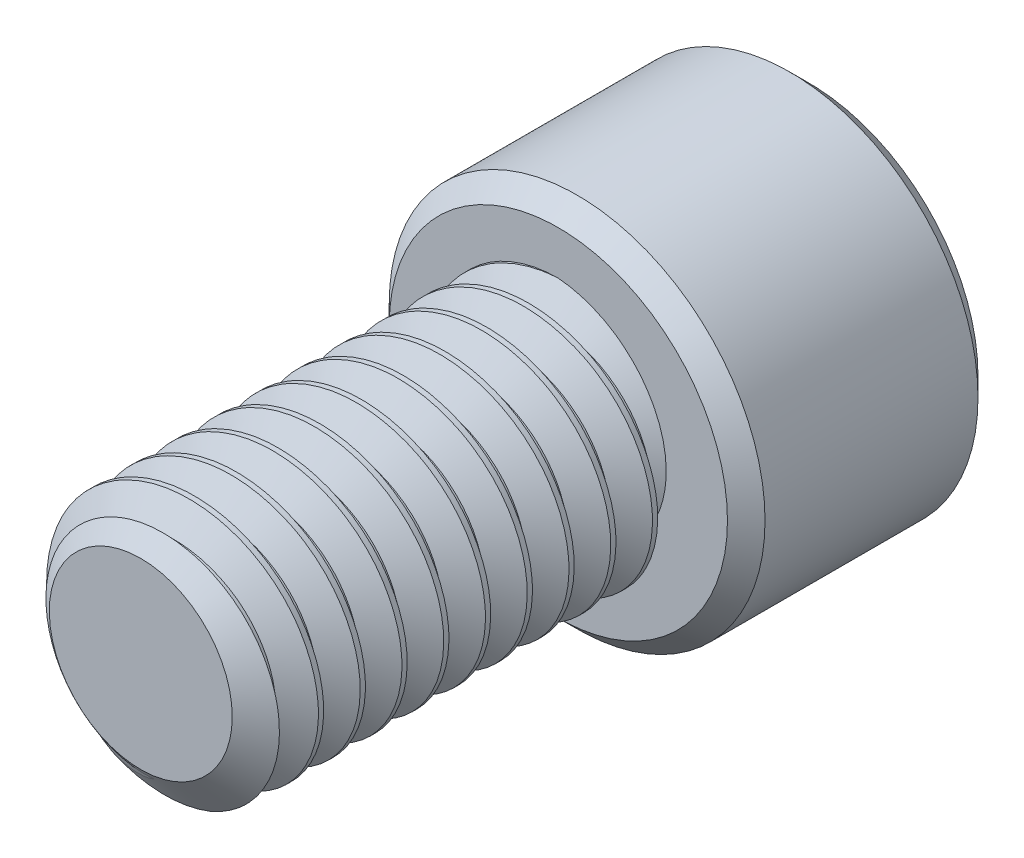
from build123d import *

# Parameters (mm, degrees)
SKETCH1_R          = 4.7625
EXTRUDE1_DEPTH     = 15.875
CUT_SWEEP1_PITCH   = 1.5875
SKETCH6_R          = 7.14375
EXTRUDE2_DEPTH     = 9.525
CUT_EXTRUDE1_DEPTH = 5.953125
CHAMFER1_SIZE      = 0.714375


with BuildPart() as part:
    # Sketch1 → Extrude1 (new body)
    with BuildSketch(Plane.XY):
        Circle(SKETCH1_R)
    extrude(amount=-EXTRUDE1_DEPTH)

    # Cut-Sweep1: the profile of Sketch3 profile screwed along a right-hand helix of 11 turns, 6 arcs to a turn; built about Z, then put on its axis
    cut_sweep1_z = Axis((0, 0, 0), (0, 0, 1))
    cut_sweep1_corners = [(4.7628, 0, -1.389235705), (3.731388504, 0, -0.79375), (3.731388504, 0, -0.5953125), (4.7628, 0, 0.000173205)]
    with BuildLine(mode=Mode.PRIVATE) as cut_sweep1_profile:
        Line(cut_sweep1_corners[0], cut_sweep1_corners[1])
        Line(cut_sweep1_corners[1], cut_sweep1_corners[2])
        Line(cut_sweep1_corners[2], cut_sweep1_corners[3])
        Line(cut_sweep1_corners[3], cut_sweep1_corners[0])
    cut_sweep1_cap = Face(cut_sweep1_profile.wire())
    cut_sweep1_turn_angles = [0, 30, 60, 90, 120, 150, 180, 210, 240, 270, 300, 330, 360]
    cut_sweep1_turn_weights = [1, 0.8660254037844387, 1, 0.8660254037844387, 1, 0.8660254037844387, 1, 0.8660254037844387, 1, 0.8660254037844387, 1, 0.8660254037844387, 1]
    cut_sweep1_turn_rails = [Edge.make_bspline([Vector(p[0], p[1], 0).rotate(cut_sweep1_z, cut_sweep1_turn_angles[k]) / cut_sweep1_turn_weights[k] + Vector(0, 0, p[2] + CUT_SWEEP1_PITCH * cut_sweep1_turn_angles[k] / 360) for k in range(13)], [0, 0, 0, 1, 1, 2, 2, 3, 3, 4, 4, 5, 5, 6, 6, 6], 2, cut_sweep1_turn_weights) for p in cut_sweep1_corners]
    cut_sweep1_turn_sides = [Face.make_surface_from_curves(cut_sweep1_turn_rails[p[0]], cut_sweep1_turn_rails[p[1]]) for p in [(0, 1), (1, 2), (2, 3), (3, 0)]]
    cut_sweep1 = Plane(origin=(0, 0, 0), x_dir=(0, 1, 0), z_dir=(0, 0, -1)) * Solid(Shell([*[p.moved(Location((0, 0, CUT_SWEEP1_PITCH * i))) for i in range(11) for p in cut_sweep1_turn_sides], cut_sweep1_cap, cut_sweep1_cap.rotate(cut_sweep1_z, 3960).moved(Location((0, 0, CUT_SWEEP1_PITCH * 3960 / 360)))]))
    add(cut_sweep1, mode=Mode.SUBTRACT)

    # Sketch4 → Cut-Revolve1 (revolve, cut)
    with BuildSketch(Plane(origin=(0, 0, 0), x_dir=(0, 0, -1), z_dir=(1, 0, 0)), mode=Mode.PRIVATE) as cut_revolve1_sk:
        Polygon((0.899844757, 4.7625), (0, 3.477388504), (0, 4.7625), align=None)
    revolve(cut_revolve1_sk.sketch.rotate(Axis((0, 0, 0), (0, 0, -1)), 219.91571201), axis=Axis((0, 0, 0), (0, 0, -1)), mode=Mode.SUBTRACT)

    # Sketch6 → Extrude2 (add)
    with BuildSketch(Plane(origin=(0, 0, -15.875), x_dir=(-1, 0, 0), z_dir=(0, 0, -1))):
        with Locations(Location((0, 0, 0), (0, 0, 180))):
            Circle(SKETCH6_R)
    extrude(amount=EXTRUDE2_DEPTH)

    # Sketch7 → Cut-Extrude1 (cut)
    with BuildSketch(Plane(origin=(0, 0, -25.4), x_dir=(-1, 0, 0), z_dir=(0, 0, -1))):
        Polygon((0, 4.582717762), (-3.96875, 2.291358881), (-3.96875, -2.291358881), (0, -4.582717762), (3.96875, -2.291358881), (3.96875, 2.291358881), align=None)
    extrude(amount=-CUT_EXTRUDE1_DEPTH, mode=Mode.SUBTRACT)

    # Cut-Extrude2 cone 1 section (through the dimple's axis) → Cut-Extrude2 (revolve, cut)
    with BuildSketch(Plane(origin=(0, 0, -25.4), x_dir=(0, 1, 0), z_dir=(1, 0, 0))):
        Polygon((0, 0), (4.582717762, 0), (0, 4.582717762), align=None)
    revolve(axis=Axis((0, 0, -25.4), (0, 0, 1)), mode=Mode.SUBTRACT)

    # Chamfer1
    chamfer1_edges = [part.edges().sort_by_distance(p)[0] for p in [
        (-7.14375, 0, -15.875),
        (-7.14375, 0, -25.4),
    ]]
    chamfer(chamfer1_edges, length=CHAMFER1_SIZE)


solid = part.part
